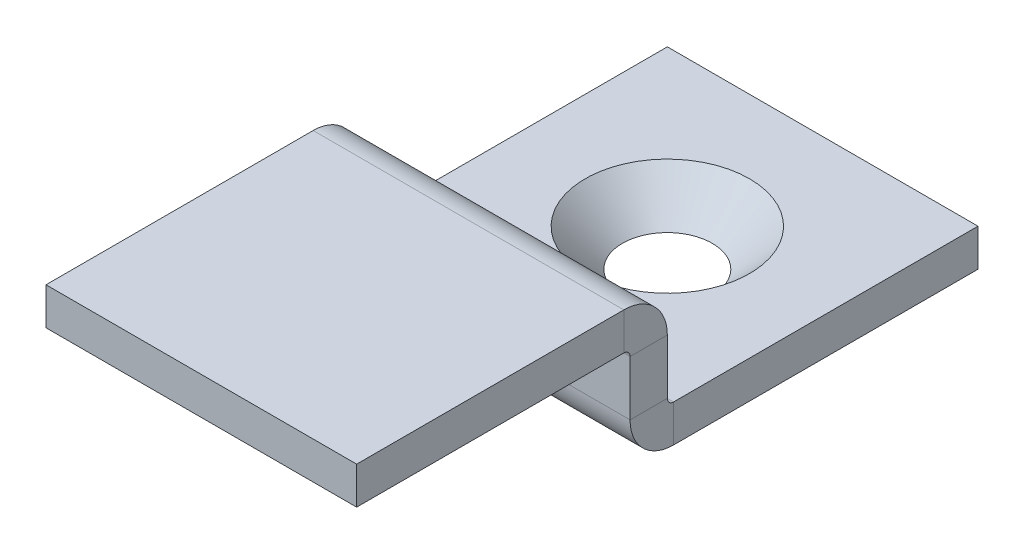
from build123d import *

# Parameters (mm, degrees)
SKETCH1_W                    = 12.7
SKETCH1_H                    = 1.524
BASE_FLANGE1_DEPTH           = 12.7
EDGE_FLANGE2_STRIP_W         = 6.604
EDGE_FLANGE2_STRIP_H         = 1.524
EDGE_FLANGE2_STRIP_CUT_DEPTH = 12.7
EDGE_FLANGE2_DEPTH           = 12.7
EDGE_FLANGE4_STRIP_W         = 6.604
EDGE_FLANGE4_STRIP_H         = 1.524
EDGE_FLANGE4_STRIP_CUT_DEPTH = 12.7
EDGE_FLANGE4_DEPTH           = 12.7


# Sheet-metal steps are written as plain solids
with BuildPart() as part:
    # Sketch1 → Base-Flange1 (new body)
    with BuildSketch(Plane.XY):
        with Locations((6.35, -0.762)):
            Rectangle(SKETCH1_W, SKETCH1_H)
    extrude(amount=BASE_FLANGE1_DEPTH)

    # Edge-Flange2 strip (across the edge) → Edge-Flange2 strip cut (cut)
    with BuildSketch(Plane(origin=(0, 0, 12.7), x_dir=(0, 0, -1), z_dir=(1, 0, 0))):
        with Locations((-3.048, -0.762)):
            Rectangle(EDGE_FLANGE2_STRIP_W, EDGE_FLANGE2_STRIP_H)
    extrude(amount=EDGE_FLANGE2_STRIP_CUT_DEPTH, mode=Mode.SUBTRACT)

    # Edge-Flange2 section (across the edge) → Edge-Flange2 (add)
    with BuildSketch(Plane(origin=(0, 0, 12.7), x_dir=(0, 0, -1), z_dir=(1, 0, 0))):
        with BuildLine():
            Line((-1.524, 0.254), (-1.524, 4.276))
            Line((-1.524, 4.276), (0, 4.276))
            Line((0, 4.276), (0, 0.254))
            ThreePointArc((0, 0.254), (0.074394878, 0.074394878), (0.254, 0))
            Line((0.254, 0), (0.254, -1.524))
            ThreePointArc((0.254, -1.524), (-1.003235857, -1.003235857), (-1.524, 0.254))
        make_face()
    extrude(amount=EDGE_FLANGE2_DEPTH)

    # Sketch10 → CSK for M3 SFHCS1 (revolve, cut)
    with BuildSketch(Plane(origin=(6.35, 0, 6.35), x_dir=(0, 0, 1), z_dir=(1, 0, 0))):
        Polygon((0, 0), (0, 1.524), (1.7, 1.524), (1.7, 1.66), (3.36, 0), align=None)
    revolve(axis=Axis((6.35, 6.35, 6.35), (0, -1, 0)), mode=Mode.SUBTRACT)

    # Edge-Flange4 strip (across the edge) → Edge-Flange4 strip cut (cut)
    with BuildSketch(Plane(origin=(12.7, 4.276, 14.224), x_dir=(0, -1, 0), z_dir=(-1, 0, 0))):
        with Locations((-1.524, -0.762)):
            Rectangle(EDGE_FLANGE4_STRIP_W, EDGE_FLANGE4_STRIP_H)
    extrude(amount=EDGE_FLANGE4_STRIP_CUT_DEPTH, mode=Mode.SUBTRACT)

    # Edge-Flange4 section (across the edge) → Edge-Flange4 (add)
    with BuildSketch(Plane(origin=(12.7, 4.276, 14.224), x_dir=(0, -1, 0), z_dir=(-1, 0, 0))):
        with BuildLine():
            Line((0, 0.254), (0, 11.176))
            Line((0, 11.176), (1.524, 11.176))
            Line((1.524, 11.176), (1.524, 0.254))
            ThreePointArc((1.524, 0.254), (1.598394878, 0.074394878), (1.778, 0))
            Line((1.778, 0), (1.778, -1.524))
            ThreePointArc((1.778, -1.524), (0.520764143, -1.003235857), (0, 0.254))
        make_face()
    extrude(amount=EDGE_FLANGE4_DEPTH)


solid = part.part
